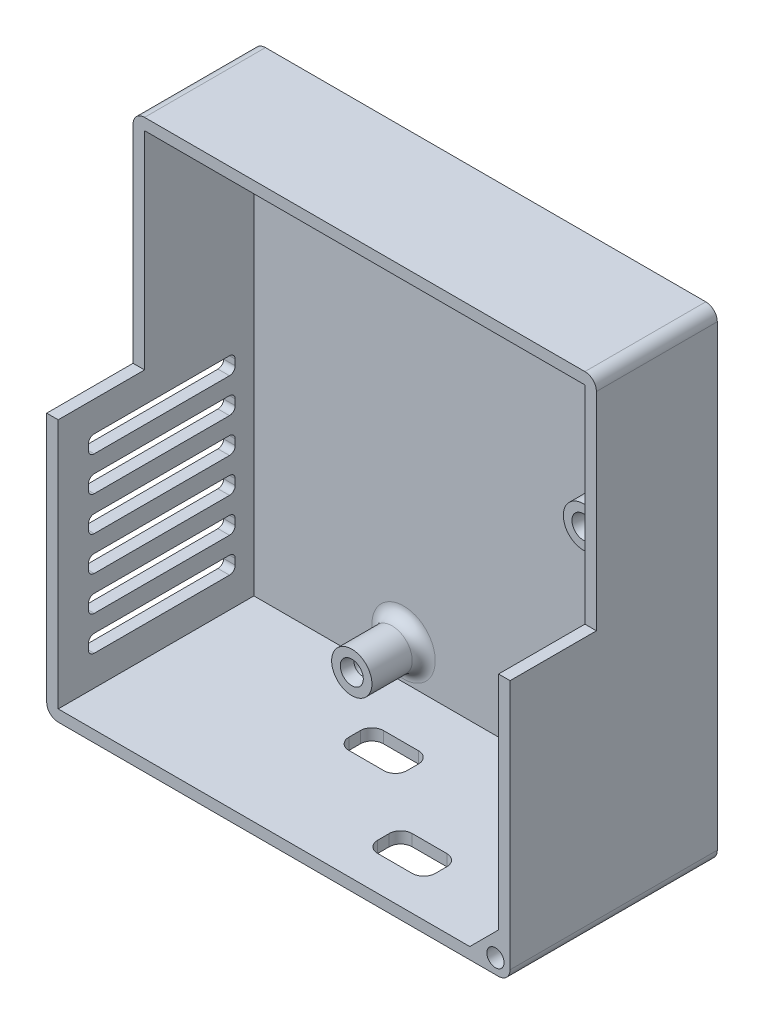
from build123d import *
from OCP.BRepFilletAPI import BRepFilletAPI_MakeChamfer

# Parameters (mm, degrees)
SKETCH1_W           = 83.5
SKETCH1_H           = 80.5
BOSS_EXTRUDE1_DEPTH = 2
SKETCH1_3_W         = 83.5
SKETCH1_3_H         = 80.5
SKETCH1_3_W_2       = 79.5
SKETCH1_3_H_2       = 76.5
SKETCH1_3_R         = 3.5
SKETCH1_3_R_2       = 1.5
BOSS_EXTRUDE2_DEPTH = 9
CHAMFER1_SIZE       = 0.5
CHAMFER1_SIZE2      = 1.866025404
SKETCH4_W           = 80.5
SKETCH4_H           = 83.5
SKETCH4_W_2         = 76.5
SKETCH4_H_2         = 79.5
BOSS_EXTRUDE3_DEPTH = 25
CUT_EXTRUDE1_DEPTH  = 16
FILLET1_R           = 2
FILLET2_R           = 2
FILLET3_R           = 2
FILLET4_R           = 2
FILLET5_R           = 2
FILLET6_R           = 2
FILLET7_R           = 2
CUT_EXTRUDE2_DEPTH  = 10
SKETCH9_W           = 15
SKETCH9_H           = 38
CUT_EXTRUDE3_DEPTH  = 81
BOSS_EXTRUDE4_DEPTH = 34
SKETCH11_R          = 1.5
CUT_EXTRUDE4_DEPTH  = 10


with BuildPart() as part:
    # Sketch1 → Boss-Extrude1 (new body)
    with BuildSketch(Plane(origin=(0, 0, 0), x_dir=(0, 1, 0), z_dir=(0, 0, 1))):
        Rectangle(SKETCH1_W, SKETCH1_H)
    extrude(amount=-BOSS_EXTRUDE1_DEPTH)

    # Sketch1<3> → Boss-Extrude2 (add)
    # profile 1 of 4: a face of its own
    with BuildSketch(Plane(origin=(0, 0, 0), x_dir=(0, 1, 0), z_dir=(0, 0, 1))):
        Rectangle(SKETCH1_3_W, SKETCH1_3_H)
        Rectangle(SKETCH1_3_W_2, SKETCH1_3_H_2, mode=Mode.SUBTRACT)
    # profile 2 of 4: a face of its own
    with BuildSketch(Plane(origin=(0, 0, 0), x_dir=(0, 1, 0), z_dir=(0, 0, 1))):
        with Locations((-33.75, 12.25)):
            Circle(SKETCH1_3_R)
        with Locations((-33.75, 12.25)):
            Circle(SKETCH1_3_R_2, mode=Mode.SUBTRACT)
    # profile 3 of 4: a face of its own
    with BuildSketch(Plane(origin=(0, 0, 0), x_dir=(0, 1, 0), z_dir=(0, 0, 1))):
        with Locations((33.75, 12.25)):
            Circle(SKETCH1_3_R)
        with Locations((33.75, 12.25)):
            Circle(SKETCH1_3_R_2, mode=Mode.SUBTRACT)
    # profile 4 of 4: a face of its own
    with BuildSketch(Plane(origin=(0, 0, 0), x_dir=(0, 1, 0), z_dir=(0, 0, 1))):
        with Locations((8.25, -28)):
            Circle(SKETCH1_3_R)
        with Locations((8.25, -28)):
            Circle(SKETCH1_3_R_2, mode=Mode.SUBTRACT)
    extrude(amount=BOSS_EXTRUDE2_DEPTH)

    # Chamfer1: one chamfer whose edges measure the first distance from different faces: ONE call of the kernel's chamfer builder (chamfer() names one face for all edges)
    chamfer1_edges_1 = [part.edges().sort_by_distance(p)[0] for p in [
        (-12.25, -35.25, 9),
    ]]
    chamfer1_side_1 = [part.faces().sort_by_distance(p)[0] for p in [
        (-12.25, -37.151005051, 9),
    ]]
    chamfer1_edges_2 = [part.edges().sort_by_distance(p)[0] for p in [
        (28, 6.75, 9),
    ]]
    chamfer1_side_2 = [part.faces().sort_by_distance(p)[0] for p in [
        (28, 4.848994949, 9),
    ]]
    chamfer1_edges_3 = [part.edges().sort_by_distance(p)[0] for p in [
        (-12.25, 32.25, 9),
    ]]
    chamfer1_side_3 = [part.faces().sort_by_distance(p)[0] for p in [
        (-12.25, 30.348994949, 9),
    ]]
    chamfer1 = BRepFilletAPI_MakeChamfer(part.part.solid().wrapped)
    for e in chamfer1_edges_1:
        chamfer1.Add(CHAMFER1_SIZE, CHAMFER1_SIZE2, e.wrapped, chamfer1_side_1[0].wrapped)  # the first distance lies on this face
    for e in chamfer1_edges_2:
        chamfer1.Add(CHAMFER1_SIZE, CHAMFER1_SIZE2, e.wrapped, chamfer1_side_2[0].wrapped)  # the first distance lies on this face
    for e in chamfer1_edges_3:
        chamfer1.Add(CHAMFER1_SIZE, CHAMFER1_SIZE2, e.wrapped, chamfer1_side_3[0].wrapped)  # the first distance lies on this face
    add(Compound.cast(chamfer1.Shape()), mode=Mode.REPLACE)

    # Sketch4 → Boss-Extrude3 (add)
    with BuildSketch(Plane.XY.offset(9)):
        Rectangle(SKETCH4_W, SKETCH4_H)
        Rectangle(SKETCH4_W_2, SKETCH4_H_2, mode=Mode.SUBTRACT)
    extrude(amount=BOSS_EXTRUDE3_DEPTH)

    # Sketch5 → Cut-Extrude1 (cut)
    with BuildSketch(Plane.XZ.offset(41.75)):
        with BuildLine():
            Line((11.25, 28), (17.25, 28))
            ThreePointArc((17.25, 28), (18.664213562, 27.414213562), (19.25, 26))
            Line((19.25, 26), (19.25, 24))
            ThreePointArc((19.25, 24), (18.664213562, 22.585786438), (17.25, 22))
            Line((17.25, 22), (11.25, 22))
            ThreePointArc((11.25, 22), (9.835786438, 22.585786438), (9.25, 24))
            Line((9.25, 24), (9.25, 26))
            ThreePointArc((9.25, 26), (9.835786438, 27.414213562), (11.25, 28))
        make_face()
        with BuildLine():
            Line((-6.75, 15), (-0.67, 15))
            ThreePointArc((-0.67, 15), (0.744213562, 14.414213562), (1.33, 13))
            Line((1.33, 13), (1.33, 11))
            ThreePointArc((1.33, 11), (0.744213562, 9.585786438), (-0.67, 9))
            Line((-0.67, 9), (-6.75, 9))
            ThreePointArc((-6.75, 9), (-8.164213562, 9.585786438), (-8.75, 11))
            Line((-8.75, 11), (-8.75, 13))
            ThreePointArc((-8.75, 13), (-8.164213562, 14.414213562), (-6.75, 15))
        make_face()
    extrude(amount=-CUT_EXTRUDE1_DEPTH, mode=Mode.SUBTRACT)

    # Fillet1
    fillet1_edges = [part.edges().sort_by_distance(p)[0] for p in [
        (40.25, -41.75, 16),
    ]]
    fillet(fillet1_edges, radius=FILLET1_R)

    # Fillet2
    fillet2_edges = [part.edges().sort_by_distance(p)[0] for p in [
        (-40.25, -41.75, 16),
    ]]
    fillet(fillet2_edges, radius=FILLET2_R)

    # Fillet3
    fillet3_edges = [part.edges().sort_by_distance(p)[0] for p in [
        (40.25, 41.75, 16),
    ]]
    fillet(fillet3_edges, radius=FILLET3_R)

    # Fillet4
    fillet4_edges = [part.edges().sort_by_distance(p)[0] for p in [
        (-40.25, 41.75, 16),
    ]]
    fillet(fillet4_edges, radius=FILLET4_R)

    # Fillet5
    fillet5_edges = [part.edges().sort_by_distance(p)[0] for p in [
        (28, 4.75, 0),
    ]]
    fillet(fillet5_edges, radius=FILLET5_R)

    # Fillet6
    fillet6_edges = [part.edges().sort_by_distance(p)[0] for p in [
        (-12.25, -37.25, 0),
    ]]
    fillet(fillet6_edges, radius=FILLET6_R)

    # Fillet7
    fillet7_edges = [part.edges().sort_by_distance(p)[0] for p in [
        (-12.25, 30.25, 0),
    ]]
    fillet(fillet7_edges, radius=FILLET7_R)

    # Sketch6 → Cut-Extrude2 (cut)
    with BuildSketch(Plane(origin=(-40.25, 0, 0), x_dir=(0, -1, 0), z_dir=(-1, 0, 0))):
        with BuildLine():
            Line((33.5, 3.25), (32.5, 3.25))
            ThreePointArc((32.5, 3.25), (31.792893219, 3.542893219), (31.5, 4.25))
            Line((31.5, 4.25), (31.5, 27.75))
            ThreePointArc((31.5, 27.75), (31.792893219, 28.457106781), (32.5, 28.75))
            Line((32.5, 28.75), (33.5, 28.75))
            ThreePointArc((33.5, 28.75), (34.207106781, 28.457106781), (34.5, 27.75))
            Line((34.5, 27.75), (34.5, 4.25))
            ThreePointArc((34.5, 4.25), (34.207106781, 3.542893219), (33.5, 3.25))
        make_face()
        with BuildLine():
            Line((28.5, 4.25), (28.5, 27.75))
            ThreePointArc((28.5, 27.75), (28.207106781, 28.457106781), (27.5, 28.75))
            Line((27.5, 28.75), (26.5, 28.75))
            ThreePointArc((26.5, 28.75), (25.792893219, 28.457106781), (25.5, 27.75))
            Line((25.5, 27.75), (25.5, 4.25))
            ThreePointArc((25.5, 4.25), (25.792893219, 3.542893219), (26.5, 3.25))
            Line((26.5, 3.25), (27.5, 3.25))
            ThreePointArc((27.5, 3.25), (28.207106781, 3.542893219), (28.5, 4.25))
        make_face()
        with BuildLine():
            Line((22.5, 4.25), (22.5, 27.75))
            ThreePointArc((22.5, 27.75), (22.207106781, 28.457106781), (21.5, 28.75))
            Line((21.5, 28.75), (20.5, 28.75))
            ThreePointArc((20.5, 28.75), (19.792893219, 28.457106781), (19.5, 27.75))
            Line((19.5, 27.75), (19.5, 4.25))
            ThreePointArc((19.5, 4.25), (19.792893219, 3.542893219), (20.5, 3.25))
            Line((20.5, 3.25), (21.5, 3.25))
            ThreePointArc((21.5, 3.25), (22.207106781, 3.542893219), (22.5, 4.25))
        make_face()
        with BuildLine():
            Line((16.5, 4.25), (16.5, 27.75))
            ThreePointArc((16.5, 27.75), (16.207106781, 28.457106781), (15.5, 28.75))
            Line((15.5, 28.75), (14.5, 28.75))
            ThreePointArc((14.5, 28.75), (13.792893219, 28.457106781), (13.5, 27.75))
            Line((13.5, 27.75), (13.5, 4.25))
            ThreePointArc((13.5, 4.25), (13.792893219, 3.542893219), (14.5, 3.25))
            Line((14.5, 3.25), (15.5, 3.25))
            ThreePointArc((15.5, 3.25), (16.207106781, 3.542893219), (16.5, 4.25))
        make_face()
        with BuildLine():
            Line((10.5, 4.25), (10.5, 27.75))
            ThreePointArc((10.5, 27.75), (10.207106781, 28.457106781), (9.5, 28.75))
            Line((9.5, 28.75), (8.5, 28.75))
            ThreePointArc((8.5, 28.75), (7.792893219, 28.457106781), (7.5, 27.75))
            Line((7.5, 27.75), (7.5, 4.25))
            ThreePointArc((7.5, 4.25), (7.792893219, 3.542893219), (8.5, 3.25))
            Line((8.5, 3.25), (9.5, 3.25))
            ThreePointArc((9.5, 3.25), (10.207106781, 3.542893219), (10.5, 4.25))
        make_face()
        with BuildLine():
            Line((4.5, 4.25), (4.5, 27.75))
            ThreePointArc((4.5, 27.75), (4.207106781, 28.457106781), (3.5, 28.75))
            Line((3.5, 28.75), (2.5, 28.75))
            ThreePointArc((2.5, 28.75), (1.792893219, 28.457106781), (1.5, 27.75))
            Line((1.5, 27.75), (1.5, 4.25))
            ThreePointArc((1.5, 4.25), (1.792893219, 3.542893219), (2.5, 3.25))
            Line((2.5, 3.25), (3.5, 3.25))
            ThreePointArc((3.5, 3.25), (4.207106781, 3.542893219), (4.5, 4.25))
        make_face()
    extrude(amount=-CUT_EXTRUDE2_DEPTH, mode=Mode.SUBTRACT)

    # Sketch9 → Cut-Extrude3 (cut)
    with BuildSketch(Plane.ZY.offset(40.25)):
        with Locations((26.5, 22.75)):
            Rectangle(SKETCH9_W, SKETCH9_H)
    extrude(amount=-CUT_EXTRUDE3_DEPTH, mode=Mode.SUBTRACT)

    # Sketch10 → Boss-Extrude4 (add)
    with BuildSketch(Plane.XY):
        Polygon((33.25, -39.75), (38.25, -34.75), (38.25, -39.75), align=None)
    extrude(amount=BOSS_EXTRUDE4_DEPTH)

    # Sketch11 → Cut-Extrude4 (cut)
    with BuildSketch(Plane.XY.offset(34)):
        with Locations((37.707106781, -39.207106781)):
            Circle(SKETCH11_R)
    extrude(amount=-CUT_EXTRUDE4_DEPTH, mode=Mode.SUBTRACT)


solid = part.part
